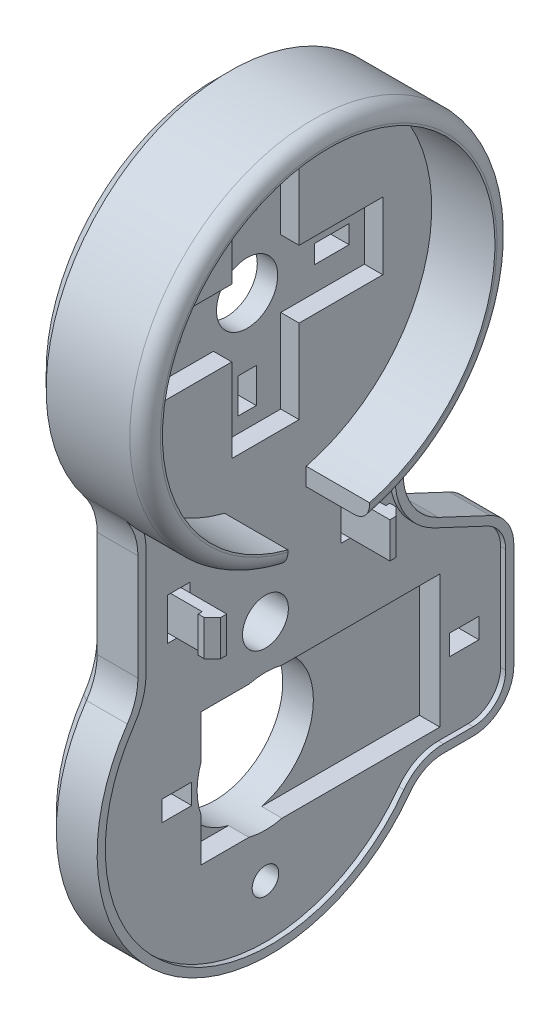
from build123d import *

# Parameters (mm, degrees)
BOSS_EXTRUDE1_START  = -60.6
BOSS_EXTRUDE1_DEPTH  = 5.5
BOSS_EXTRUDE2_START  = -55.6
BOSS_EXTRUDE2_DEPTH  = 0.6
BOSS_EXTRUDE3_START  = -55.6
SKETCH3_R            = 18
SKETCH3_R_2          = 16.3
BOSS_EXTRUDE3_DEPTH  = 6.2
CHAMFER1_SIZE        = 1.5
FILLET1_R            = 1.5
BOSS_EXTRUDE4_START  = -55.3
SKETCH4_W            = 2.3
SKETCH4_H            = 23
BOSS_EXTRUDE4_DEPTH  = 6.6
BOSS_EXTRUDE5_START  = -63.5
SKETCH5_W            = 2.3
SKETCH5_H            = 6.6
BOSS_EXTRUDE5_DEPTH  = 23
BOSS_EXTRUDE6_START  = -57.4
SKETCH6_R            = 4.6
BOSS_EXTRUDE6_DEPTH  = 2.3
BOSS_EXTRUDE7_START  = -61.1
SKETCH7_R            = 6.1
BOSS_EXTRUDE7_DEPTH  = 1.7
BOSS_EXTRUDE8_START  = -59.5
SKETCH8_R            = 3
BOSS_EXTRUDE8_DEPTH  = 2.2
BOSS_EXTRUDE9_START  = -52.9
SKETCH9_W            = 2.3
SKETCH9_H            = 3.4
BOSS_EXTRUDE9_DEPTH  = 1.8
BOSS_EXTRUDE10_START = -62
SKETCH10_W           = 2.3
SKETCH10_H           = 1.8
BOSS_EXTRUDE10_DEPTH = 3.4
BOSS_EXTRUDE11_START = -52.9
SKETCH11_W           = 2.3
SKETCH11_H           = 3.4
BOSS_EXTRUDE11_DEPTH = 1.8
BOSS_EXTRUDE12_START = -45.4
SKETCH12_W           = 2.3
SKETCH12_H           = 1.8
BOSS_EXTRUDE12_DEPTH = 3.4
BOSS_EXTRUDE13_START = -56
SKETCH13_W           = 6.3
SKETCH13_H           = 3.098417801
BOSS_EXTRUDE13_DEPTH = 8
BOSS_EXTRUDE14_START = -44.775
SKETCH14_W           = 4.1
SKETCH14_H           = 2
BOSS_EXTRUDE14_DEPTH = 2.9
BOSS_EXTRUDE15_START = -72.925
SKETCH15_W           = 4.1
SKETCH15_H           = 2
BOSS_EXTRUDE15_DEPTH = 2.9
BOSS_EXTRUDE16_START = -69.1
SKETCH16_W           = 2.1
SKETCH16_H           = 13
BOSS_EXTRUDE16_DEPTH = 23.4
BOSS_EXTRUDE17_START = -61.1
SKETCH17_R           = 6.7
BOSS_EXTRUDE17_DEPTH = 5.6
BOSS_EXTRUDE18_START = -61.1
SKETCH18_R           = 2.25
BOSS_EXTRUDE18_DEPTH = 5.6
BOSS_EXTRUDE19_START = -61.1
SKETCH19_R           = 2.3
BOSS_EXTRUDE19_DEPTH = 1.9
BOSS_EXTRUDE20_START = -59.25
SKETCH20_R           = 1.3
BOSS_EXTRUDE20_DEPTH = 3.75
BOSS_EXTRUDE21_START = -44.6
SKETCH21_W           = 3.1
SKETCH21_H           = 4.1
BOSS_EXTRUDE21_DEPTH = 2.2
BOSS_EXTRUDE22_START = -5.75
BOSS_EXTRUDE22_DEPTH = 3.5
BOSS_EXTRUDE23_START = -61.6
SKETCH23_W           = 3.1
SKETCH23_H           = 4.1
BOSS_EXTRUDE23_DEPTH = 2.2
BOSS_EXTRUDE24_START = -5.75
BOSS_EXTRUDE24_DEPTH = 3.5


with BuildPart() as part:
    # Sketch1 → Boss-Extrude1 (new body)
    with BuildSketch(Plane(origin=(0, 0, 0), x_dir=(0, 0, -1), z_dir=(1, 0, 0)).offset(BOSS_EXTRUDE1_START)):
        with BuildLine():
            Line((39, 3.337121701), (39, -7.038518603))
            ThreePointArc((39, -7.038518603), (38.733198515, -8.807822077), (37.956521739, -10.41977462))
            ThreePointArc((37.956521739, -10.41977462), (42.18950583, -33.883594784), (65.719936005, -30.038095238))
            ThreePointArc((65.719936005, -30.038095238), (67.138131249, -28.832955071), (68.948156242, -28.4))
            Line((68.948156242, -28.4), (71.85, -28.4))
            ThreePointArc((71.85, -28.4), (74.678427125, -27.228427125), (75.85, -24.4))
            Line((75.85, -24.4), (75.85, -14.139667829))
            ThreePointArc((75.85, -14.139667829), (75.226856881, -11.995644133), (73.551581196, -10.519637244))
            Line((73.551581196, -10.519637244), (68.447628205, -8.120544133))
            ThreePointArc((68.447628205, -8.120544133), (65.934714679, -5.9065338), (65, -2.690498257))
            Line((65, -2.690498257), (65, 3.337121701))
            ThreePointArc((65, 3.337121701), (65.321091654, 5.273613374), (66.25, 7.002841276))
            ThreePointArc((66.25, 7.002841276), (52, 36), (37.75, 7.002841276))
            ThreePointArc((37.75, 7.002841276), (38.678908346, 5.273613374), (39, 3.337121701))
        make_face()
    extrude(amount=BOSS_EXTRUDE1_DEPTH)


with BuildPart() as body_2:
    # Sketch2 → Boss-Extrude2 (new body)
    with BuildSketch(Plane(origin=(0, 0, 0), x_dir=(0, 0, -1), z_dir=(1, 0, 0)).offset(BOSS_EXTRUDE2_START)):
        with BuildLine():
            Line((39.8, 3.337121701), (39.8, -7.038518603))
            ThreePointArc((39.8, -7.038518603), (39.497624984, -9.043729207), (38.617391304, -10.870608755))
            ThreePointArc((38.617391304, -10.870608755), (42.651176143, -33.230249147), (65.074291958, -29.565714286))
            ThreePointArc((65.074291958, -29.565714286), (66.77612625, -28.119546085), (68.948156242, -27.6))
            Line((68.948156242, -27.6), (71.85, -27.6))
            ThreePointArc((71.85, -27.6), (74.1127417, -26.6627417), (75.05, -24.4))
            Line((75.05, -24.4), (75.05, -14.139667829))
            ThreePointArc((75.05, -14.139667829), (74.551485505, -12.424448872), (73.211264957, -11.243643361))
            Line((73.211264957, -11.243643361), (68.107311966, -8.84455025))
            ThreePointArc((68.107311966, -8.84455025), (65.259343303, -6.335338539), (64.2, -2.690498257))
            Line((64.2, -2.690498257), (64.2, 3.337121701))
            ThreePointArc((64.2, 3.337121701), (64.563903875, 5.531812264), (65.616666667, 7.491603886))
            ThreePointArc((65.616666667, 7.491603886), (52, 35.2), (38.383333333, 7.491603886))
            ThreePointArc((38.383333333, 7.491603886), (39.436096125, 5.531812264), (39.8, 3.337121701))
        make_face()
    extrude(amount=BOSS_EXTRUDE2_DEPTH)


with BuildPart() as part_1:
    add(part.part)

    # Combine1: cut body 2
    add(body_2.part, mode=Mode.SUBTRACT)

    # Sketch3 → Boss-Extrude3 (add)
    with BuildSketch(Plane(origin=(0, 0, 0), x_dir=(0, 0, -1), z_dir=(1, 0, 0)).offset(BOSS_EXTRUDE3_START)):
        with Locations((52, 18)):
            Circle(SKETCH3_R)
        with Locations((52, 18)):
            Circle(SKETCH3_R_2, mode=Mode.SUBTRACT)
    extrude(amount=BOSS_EXTRUDE3_DEPTH)

    # Chamfer1
    chamfer1_edges = [part_1.edges().sort_by_distance(p)[0] for p in [
        (-60.6, -5.9065338, -65.934714679),
        (-60.6, 0.323311722, -65),
        (-60.6, -9.320090689, -70.999604701),
        (-60.6, 5.273613374, -65.321091654),
        (-60.6, -11.995644133, -75.226856881),
        (-60.6, 36, -52),
        (-60.6, -19.269833914, -75.85),
        (-60.6, 5.273613374, -38.678908346),
        (-60.6, -27.228427125, -74.678427125),
        (-60.6, -1.850698451, -39),
        (-60.6, -28.4, -70.399078121),
        (-60.6, -8.807822077, -38.733198515),
        (-60.6, -28.832955071, -67.138131249),
        (-60.6, -33.883594784, -42.18950583),
    ]]
    chamfer(chamfer1_edges, length=CHAMFER1_SIZE)

    # Fillet1
    fillet1_edges = [part_1.edges().sort_by_distance(p)[0] for p in [
        (-49.4, 18, -34),
    ]]
    fillet(fillet1_edges, radius=FILLET1_R)


with BuildPart() as body_2_2:
    # Sketch4 → Boss-Extrude4 (new body)
    with BuildSketch(Plane.XY.offset(BOSS_EXTRUDE4_START)):
        with Locations((-56.25, 18)):
            Rectangle(SKETCH4_W, SKETCH4_H)
    extrude(amount=BOSS_EXTRUDE4_DEPTH)


with BuildPart() as part_2:
    add(part_1.part)

    # Combine2: cut body 2 2
    add(body_2_2.part, mode=Mode.SUBTRACT)


with BuildPart() as body_2_3:
    # Sketch5 → Boss-Extrude5 (new body)
    with BuildSketch(Plane.XY.offset(BOSS_EXTRUDE5_START)):
        with Locations((-56.25, 18)):
            Rectangle(SKETCH5_W, SKETCH5_H)
    extrude(amount=BOSS_EXTRUDE5_DEPTH)


with BuildPart() as part_3:
    add(part_2.part)

    # Combine3: cut body 2 3
    add(body_2_3.part, mode=Mode.SUBTRACT)


with BuildPart() as body_2_4:
    # Sketch6 → Boss-Extrude6 (new body)
    with BuildSketch(Plane(origin=(0, 0, 0), x_dir=(0, 0, -1), z_dir=(1, 0, 0)).offset(BOSS_EXTRUDE6_START)):
        with Locations((52, 18)):
            Circle(SKETCH6_R)
    extrude(amount=BOSS_EXTRUDE6_DEPTH)


with BuildPart() as part_4:
    add(part_3.part)

    # Combine4: cut body 2 4
    add(body_2_4.part, mode=Mode.SUBTRACT)


with BuildPart() as body_2_5:
    # Sketch7 → Boss-Extrude7 (new body)
    with BuildSketch(Plane(origin=(0, 0, 0), x_dir=(0, 0, -1), z_dir=(1, 0, 0)).offset(BOSS_EXTRUDE7_START)):
        with Locations((52, 18)):
            Circle(SKETCH7_R)
    extrude(amount=BOSS_EXTRUDE7_DEPTH)


with BuildPart() as part_5:
    add(part_4.part)

    # Combine5: cut body 2 5
    add(body_2_5.part, mode=Mode.SUBTRACT)


with BuildPart() as body_2_6:
    # Sketch8 → Boss-Extrude8 (new body)
    with BuildSketch(Plane(origin=(0, 0, 0), x_dir=(0, 0, -1), z_dir=(1, 0, 0)).offset(BOSS_EXTRUDE8_START)):
        with Locations((52, 18)):
            Circle(SKETCH8_R)
    extrude(amount=BOSS_EXTRUDE8_DEPTH)


with BuildPart() as part_6:
    add(part_5.part)

    # Combine6: cut body 2 6
    add(body_2_6.part, mode=Mode.SUBTRACT)


with BuildPart() as body_2_7:
    # Sketch9 → Boss-Extrude9 (new body)
    with BuildSketch(Plane.XY.offset(BOSS_EXTRUDE9_START)):
        with Locations((-58.45, 26.3)):
            Rectangle(SKETCH9_W, SKETCH9_H)
    extrude(amount=BOSS_EXTRUDE9_DEPTH)


with BuildPart() as part_7:
    add(part_6.part)

    # Combine7: cut body 2 7
    add(body_2_7.part, mode=Mode.SUBTRACT)


with BuildPart() as body_2_8:
    # Sketch10 → Boss-Extrude10 (new body)
    with BuildSketch(Plane.XY.offset(BOSS_EXTRUDE10_START)):
        with Locations((-58.45, 18)):
            Rectangle(SKETCH10_W, SKETCH10_H)
    extrude(amount=BOSS_EXTRUDE10_DEPTH)


with BuildPart() as part_8:
    add(part_7.part)

    # Combine8: cut body 2 8
    add(body_2_8.part, mode=Mode.SUBTRACT)


with BuildPart() as body_2_9:
    # Sketch11 → Boss-Extrude11 (new body)
    with BuildSketch(Plane.XY.offset(BOSS_EXTRUDE11_START)):
        with Locations((-58.45, 9.7)):
            Rectangle(SKETCH11_W, SKETCH11_H)
    extrude(amount=BOSS_EXTRUDE11_DEPTH)


with BuildPart() as part_9:
    add(part_8.part)

    # Combine9: cut body 2 9
    add(body_2_9.part, mode=Mode.SUBTRACT)


with BuildPart() as body_2_10:
    # Sketch12 → Boss-Extrude12 (new body)
    with BuildSketch(Plane.XY.offset(BOSS_EXTRUDE12_START)):
        with Locations((-58.45, 18)):
            Rectangle(SKETCH12_W, SKETCH12_H)
    extrude(amount=BOSS_EXTRUDE12_DEPTH)


with BuildPart() as part_10:
    add(part_9.part)

    # Combine10: cut body 2 10
    add(body_2_10.part, mode=Mode.SUBTRACT)


with BuildPart() as body_2_11:
    # Sketch13 → Boss-Extrude13 (new body)
    with BuildSketch(Plane.XY.offset(BOSS_EXTRUDE13_START)):
        with Locations((-52.45, 0.9492089)):
            Rectangle(SKETCH13_W, SKETCH13_H)
    extrude(amount=BOSS_EXTRUDE13_DEPTH)


with BuildPart() as part_11:
    add(part_10.part)

    # Combine11: cut body 2 11
    add(body_2_11.part, mode=Mode.SUBTRACT)


with BuildPart() as body_2_12:
    # Sketch14 → Boss-Extrude14 (new body)
    with BuildSketch(Plane.XY.offset(BOSS_EXTRUDE14_START)):
        with Locations((-57.55, -20)):
            Rectangle(SKETCH14_W, SKETCH14_H)
    extrude(amount=BOSS_EXTRUDE14_DEPTH)


with BuildPart() as part_12:
    add(part_11.part)

    # Combine12: cut body 2 12
    add(body_2_12.part, mode=Mode.SUBTRACT)


with BuildPart() as body_2_13:
    # Sketch15 → Boss-Extrude15 (new body)
    with BuildSketch(Plane.XY.offset(BOSS_EXTRUDE15_START)):
        with Locations((-57.55, -20)):
            Rectangle(SKETCH15_W, SKETCH15_H)
    extrude(amount=BOSS_EXTRUDE15_DEPTH)


with BuildPart() as part_13:
    add(part_12.part)

    # Combine13: cut body 2 13
    add(body_2_13.part, mode=Mode.SUBTRACT)


with BuildPart() as body_2_14:
    # Sketch16 → Boss-Extrude16 (new body)
    with BuildSketch(Plane.XY.offset(BOSS_EXTRUDE16_START)):
        with Locations((-56.55, -20)):
            Rectangle(SKETCH16_W, SKETCH16_H)
    extrude(amount=BOSS_EXTRUDE16_DEPTH)


with BuildPart() as part_14:
    add(part_13.part)

    # Combine14: cut body 2 14
    add(body_2_14.part, mode=Mode.SUBTRACT)


with BuildPart() as body_2_15:
    # Sketch17 → Boss-Extrude17 (new body)
    with BuildSketch(Plane(origin=(0, 0, 0), x_dir=(0, 0, -1), z_dir=(1, 0, 0)).offset(BOSS_EXTRUDE17_START)):
        with Locations((52, -20)):
            Circle(SKETCH17_R)
    extrude(amount=BOSS_EXTRUDE17_DEPTH)


with BuildPart() as part_15:
    add(part_14.part)

    # Combine15: cut body 2 15
    add(body_2_15.part, mode=Mode.SUBTRACT)


with BuildPart() as body_2_16:
    # Sketch18 → Boss-Extrude18 (new body)
    with BuildSketch(Plane(origin=(0, 0, 0), x_dir=(0, 0, -1), z_dir=(1, 0, 0)).offset(BOSS_EXTRUDE18_START)):
        with Locations((52, -9)):
            Circle(SKETCH18_R)
    extrude(amount=BOSS_EXTRUDE18_DEPTH)


with BuildPart() as part_16:
    add(part_15.part)

    # Combine16: cut body 2 16
    add(body_2_16.part, mode=Mode.SUBTRACT)


with BuildPart() as body_2_17:
    # Sketch19 → Boss-Extrude19 (new body)
    with BuildSketch(Plane(origin=(0, 0, 0), x_dir=(0, 0, -1), z_dir=(1, 0, 0)).offset(BOSS_EXTRUDE19_START)):
        with Locations((52, -31)):
            Circle(SKETCH19_R)
    extrude(amount=BOSS_EXTRUDE19_DEPTH)


with BuildPart() as part_17:
    add(part_16.part)

    # Combine17: cut body 2 17
    add(body_2_17.part, mode=Mode.SUBTRACT)


with BuildPart() as body_2_18:
    # Sketch20 → Boss-Extrude20 (new body)
    with BuildSketch(Plane(origin=(0, 0, 0), x_dir=(0, 0, -1), z_dir=(1, 0, 0)).offset(BOSS_EXTRUDE20_START)):
        with Locations((52, -31)):
            Circle(SKETCH20_R)
    extrude(amount=BOSS_EXTRUDE20_DEPTH)


with BuildPart() as part_18:
    add(part_17.part)

    # Combine18: cut body 2 18
    add(body_2_18.part, mode=Mode.SUBTRACT)


with BuildPart() as body_2_19:
    # Sketch21 → Boss-Extrude21 (new body)
    with BuildSketch(Plane.XY.offset(BOSS_EXTRUDE21_START)):
        with Locations((-57.05, -4)):
            Rectangle(SKETCH21_W, SKETCH21_H)
    extrude(amount=BOSS_EXTRUDE21_DEPTH)


with BuildPart() as part_19:
    add(part_18.part)

    # Combine19: cut body 2 19
    add(body_2_19.part, mode=Mode.SUBTRACT)

    # Sketch22 → Boss-Extrude22 (add)
    with BuildSketch(Plane(origin=(0, 0, 0), x_dir=(1, 0, 0), z_dir=(0, 1, 0)).offset(BOSS_EXTRUDE22_START)):
        Polygon((-58.8, 44), (-58.8, 43), (-52.8, 43), (-52.8, 42.6), (-52.2, 42.6), (-51.4, 43.4), (-51.4, 44), align=None)
    extrude(amount=BOSS_EXTRUDE22_DEPTH)


with BuildPart() as body_2_20:
    # Sketch23 → Boss-Extrude23 (new body)
    with BuildSketch(Plane.XY.offset(BOSS_EXTRUDE23_START)):
        with Locations((-57.05, -4)):
            Rectangle(SKETCH23_W, SKETCH23_H)
    extrude(amount=BOSS_EXTRUDE23_DEPTH)


with BuildPart() as part_20:
    add(part_19.part)

    # Combine20: cut body 2 20
    add(body_2_20.part, mode=Mode.SUBTRACT)

    # Sketch24 → Boss-Extrude24 (add)
    with BuildSketch(Plane(origin=(0, 0, 0), x_dir=(1, 0, 0), z_dir=(0, 1, 0)).offset(BOSS_EXTRUDE24_START)):
        Polygon((-58.8, 60), (-58.8, 61), (-52.8, 61), (-52.8, 61.4), (-52.2, 61.4), (-51.4, 60.6), (-51.4, 60), align=None)
    extrude(amount=BOSS_EXTRUDE24_DEPTH)


solid = part_20.part
